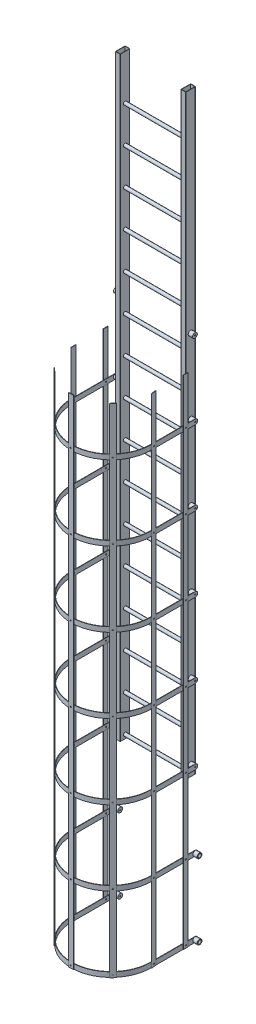
from build123d import *

# Parameters (mm, degrees)
BASE_FLANGE1_DEPTH    = 4900
SKETCH11_R            = 20
SKETCH11_R_2          = 5
BOSS_EXTRUDE2_DEPTH   = 35
BOSS_EXTRUDE2_2_DEPTH = 35
BOSS_EXTRUDE2_3_DEPTH = 35
BOSS_EXTRUDE2_4_DEPTH = 35
BOSS_EXTRUDE2_5_DEPTH = 35
SKETCH8_R             = 13.5
SKETCH8_R_2           = 11
BOSS_EXTRUDE1_DEPTH   = 500
SKETCH13_R            = 5
BASE_FLANGE2_DEPTH    = 3
LPATTERN1_COUNT       = 5
LPATTERN1_PITCH       = 615
BASE_FLANGE4_DEPTH    = 40
LPATTERN2_COUNT       = 7
LPATTERN2_PITCH       = 615
SKETCH62_W            = 40
SKETCH62_H            = 4094.908970127
TAB2_DEPTH            = 3
SKETCH102_R           = 5
CUT_EXTRUDE4_DEPTH    = 6
LPATTERN3_COUNT       = 2
LPATTERN3_PITCH       = 264
LPATTERN12_COUNT      = 2
LPATTERN12_PITCH      = 264
CIRPATTERN1_COUNT     = 5
CIRPATTERN1_ANGLE     = 187
LPATTERN4_COUNT       = 3
LPATTERN4_PITCH       = 615
SKETCH89_R            = 20
SKETCH89_R_2          = 4.25
BOSS_EXTRUDE3_DEPTH   = 35
LPATTERN5_COUNT       = 2
LPATTERN5_PITCH       = 615
SKETCH93_R            = 20
BOSS_EXTRUDE4_DEPTH   = 35
SKETCH94_R            = 4.25
CUT_EXTRUDE1_DEPTH    = 10.78
SKETCH96_R            = 4.25
SKETCH95_R            = 15.025
LPATTERN7_COUNT       = 2
LPATTERN7_PITCH       = 615
LPATTERN8_COUNT       = 2
LPATTERN8_PITCH       = 615


# Sheet-metal steps are written as plain solids
with BuildPart() as part:
    # Sketch1 → Base-Flange1 (new body)
    with BuildSketch(Plane(origin=(0, 0, 0), x_dir=(1, 0, 0), z_dir=(0, 1, 0))):
        with BuildLine():
            Line((-290, 37), (-290, -37))
            ThreePointArc((-290, -37), (-289.121320344, -39.121320344), (-287, -40))
            Line((-287, -40), (-253, -40))
            ThreePointArc((-253, -40), (-250.878679656, -39.121320344), (-250, -37))
            Line((-250, -37), (-250, 37))
            ThreePointArc((-250, 37), (-250.878679656, 39.121320344), (-253, 40))
            Line((-253, 40), (-287, 40))
            ThreePointArc((-287, 40), (-289.121320344, 39.121320344), (-290, 37))
        make_face()
        with BuildLine():
            Line((-287, 37.5), (-253, 37.5))
            ThreePointArc((-253, 37.5), (-252.646446609, 37.353553391), (-252.5, 37))
            Line((-252.5, 37), (-252.5, -37))
            ThreePointArc((-252.5, -37), (-252.646446609, -37.353553391), (-253, -37.5))
            Line((-253, -37.5), (-287, -37.5))
            ThreePointArc((-287, -37.5), (-287.353553391, -37.353553391), (-287.5, -37))
            Line((-287.5, -37), (-287.5, 37))
            ThreePointArc((-287.5, 37), (-287.353553391, 37.353553391), (-287, 37.5))
        make_face(mode=Mode.SUBTRACT)
    extrude(amount=-BASE_FLANGE1_DEPTH)


with BuildPart() as body_2:
    # Sketch11 → Boss-Extrude2 (new body)
    with BuildSketch(Plane.ZY.offset(290)):
        with Locations((0, -4812)):
            Circle(SKETCH11_R)
        with Locations((0, -4812)):
            Circle(SKETCH11_R_2, mode=Mode.SUBTRACT)
    extrude(amount=BOSS_EXTRUDE2_DEPTH)


with BuildPart() as body_3:
    # Sketch11 → Boss-Extrude2 2 (new body)
    with BuildSketch(Plane.ZY.offset(290)):
        with Locations((0, -4197)):
            Circle(SKETCH11_R)
        with Locations((0, -4197)):
            Circle(SKETCH11_R_2, mode=Mode.SUBTRACT)
    extrude(amount=BOSS_EXTRUDE2_2_DEPTH)


with BuildPart() as body_4:
    # Sketch11 → Boss-Extrude2 3 (new body)
    with BuildSketch(Plane.ZY.offset(290)):
        with Locations((0, -3582)):
            Circle(SKETCH11_R)
        with Locations((0, -3582)):
            Circle(SKETCH11_R_2, mode=Mode.SUBTRACT)
    extrude(amount=BOSS_EXTRUDE2_3_DEPTH)


with BuildPart() as body_5:
    # Sketch11 → Boss-Extrude2 4 (new body)
    with BuildSketch(Plane.ZY.offset(290)):
        with Locations((0, -2967)):
            Circle(SKETCH11_R)
        with Locations((0, -2967)):
            Circle(SKETCH11_R_2, mode=Mode.SUBTRACT)
    extrude(amount=BOSS_EXTRUDE2_4_DEPTH)


with BuildPart() as body_6:
    # Sketch11 → Boss-Extrude2 5 (new body)
    with BuildSketch(Plane.ZY.offset(290)):
        with Locations((0, -2352)):
            Circle(SKETCH11_R)
        with Locations((0, -2352)):
            Circle(SKETCH11_R_2, mode=Mode.SUBTRACT)
    extrude(amount=BOSS_EXTRUDE2_5_DEPTH)


with BuildPart() as body_7:
    # Mirror1: mirrored copy
    add(part.part.mirror(Plane(origin=(0, 0, 0), x_dir=(0, 0, 1), z_dir=(1, 0, 0))))


with BuildPart() as body_8:
    # Mirror1 2: mirrored copy
    add(body_2.part.mirror(Plane(origin=(0, 0, 0), x_dir=(0, 0, 1), z_dir=(1, 0, 0))))


with BuildPart() as body_9:
    # Mirror1 3: mirrored copy
    add(body_3.part.mirror(Plane(origin=(0, 0, 0), x_dir=(0, 0, 1), z_dir=(1, 0, 0))))


with BuildPart() as body_10:
    # Mirror1 4: mirrored copy
    add(body_4.part.mirror(Plane(origin=(0, 0, 0), x_dir=(0, 0, 1), z_dir=(1, 0, 0))))


with BuildPart() as body_11:
    # Mirror1 5: mirrored copy
    add(body_5.part.mirror(Plane(origin=(0, 0, 0), x_dir=(0, 0, 1), z_dir=(1, 0, 0))))


with BuildPart() as body_12:
    # Mirror1 6: mirrored copy
    add(body_6.part.mirror(Plane(origin=(0, 0, 0), x_dir=(0, 0, 1), z_dir=(1, 0, 0))))


with BuildPart() as part_1:
    add(part.part)

    add(body_7.part)  # Boss-Extrude1 merges body 7
    # Sketch8 → Boss-Extrude1 (add)
    # profile 1 of 16: a face of its own
    with BuildSketch(Plane(origin=(-250, 0, 0), x_dir=(0, 0, -1), z_dir=(1, 0, 0))):
        with Locations(Location((0, -367, 0), (0, 0, 180))):
            Circle(SKETCH8_R)
        with Locations(Location((0, -367, 0), (0, 0, 180))):
            Circle(SKETCH8_R_2, mode=Mode.SUBTRACT)
    # profile 2 of 16: a face of its own
    with BuildSketch(Plane(origin=(-250, 0, 0), x_dir=(0, 0, -1), z_dir=(1, 0, 0))):
        with Locations(Location((0, -667, 0), (0, 0, 180))):
            Circle(SKETCH8_R)
        with Locations(Location((0, -667, 0), (0, 0, 180))):
            Circle(SKETCH8_R_2, mode=Mode.SUBTRACT)
    # profile 3 of 16: a face of its own
    with BuildSketch(Plane(origin=(-250, 0, 0), x_dir=(0, 0, -1), z_dir=(1, 0, 0))):
        with Locations(Location((0, -967, 0), (0, 0, 180))):
            Circle(SKETCH8_R)
        with Locations(Location((0, -967, 0), (0, 0, 180))):
            Circle(SKETCH8_R_2, mode=Mode.SUBTRACT)
    # profile 4 of 16: a face of its own
    with BuildSketch(Plane(origin=(-250, 0, 0), x_dir=(0, 0, -1), z_dir=(1, 0, 0))):
        with Locations(Location((0, -1267, 0), (0, 0, 180))):
            Circle(SKETCH8_R)
        with Locations(Location((0, -1267, 0), (0, 0, 180))):
            Circle(SKETCH8_R_2, mode=Mode.SUBTRACT)
    # profile 5 of 16: a face of its own
    with BuildSketch(Plane(origin=(-250, 0, 0), x_dir=(0, 0, -1), z_dir=(1, 0, 0))):
        with Locations(Location((0, -1567, 0), (0, 0, 180))):
            Circle(SKETCH8_R)
        with Locations(Location((0, -1567, 0), (0, 0, 180))):
            Circle(SKETCH8_R_2, mode=Mode.SUBTRACT)
    # profile 6 of 16: a face of its own
    with BuildSketch(Plane(origin=(-250, 0, 0), x_dir=(0, 0, -1), z_dir=(1, 0, 0))):
        with Locations(Location((0, -1867, 0), (0, 0, 180))):
            Circle(SKETCH8_R)
        with Locations(Location((0, -1867, 0), (0, 0, 180))):
            Circle(SKETCH8_R_2, mode=Mode.SUBTRACT)
    # profile 7 of 16: a face of its own
    with BuildSketch(Plane(origin=(-250, 0, 0), x_dir=(0, 0, -1), z_dir=(1, 0, 0))):
        with Locations(Location((0, -2167, 0), (0, 0, 180))):
            Circle(SKETCH8_R)
        with Locations(Location((0, -2167, 0), (0, 0, 180))):
            Circle(SKETCH8_R_2, mode=Mode.SUBTRACT)
    # profile 8 of 16: a face of its own
    with BuildSketch(Plane(origin=(-250, 0, 0), x_dir=(0, 0, -1), z_dir=(1, 0, 0))):
        with Locations(Location((0, -2467, 0), (0, 0, 180))):
            Circle(SKETCH8_R)
        with Locations(Location((0, -2467, 0), (0, 0, 180))):
            Circle(SKETCH8_R_2, mode=Mode.SUBTRACT)
    # profile 9 of 16: a face of its own
    with BuildSketch(Plane(origin=(-250, 0, 0), x_dir=(0, 0, -1), z_dir=(1, 0, 0))):
        with Locations(Location((0, -2767, 0), (0, 0, 180))):
            Circle(SKETCH8_R)
        with Locations(Location((0, -2767, 0), (0, 0, 180))):
            Circle(SKETCH8_R_2, mode=Mode.SUBTRACT)
    # profile 10 of 16: a face of its own
    with BuildSketch(Plane(origin=(-250, 0, 0), x_dir=(0, 0, -1), z_dir=(1, 0, 0))):
        with Locations(Location((0, -3067, 0), (0, 0, 180))):
            Circle(SKETCH8_R)
        with Locations(Location((0, -3067, 0), (0, 0, 180))):
            Circle(SKETCH8_R_2, mode=Mode.SUBTRACT)
    # profile 11 of 16: a face of its own
    with BuildSketch(Plane(origin=(-250, 0, 0), x_dir=(0, 0, -1), z_dir=(1, 0, 0))):
        with Locations(Location((0, -3367, 0), (0, 0, 180))):
            Circle(SKETCH8_R)
        with Locations(Location((0, -3367, 0), (0, 0, 180))):
            Circle(SKETCH8_R_2, mode=Mode.SUBTRACT)
    # profile 12 of 16: a face of its own
    with BuildSketch(Plane(origin=(-250, 0, 0), x_dir=(0, 0, -1), z_dir=(1, 0, 0))):
        with Locations(Location((0, -3667, 0), (0, 0, 180))):
            Circle(SKETCH8_R)
        with Locations(Location((0, -3667, 0), (0, 0, 180))):
            Circle(SKETCH8_R_2, mode=Mode.SUBTRACT)
    # profile 13 of 16: a face of its own
    with BuildSketch(Plane(origin=(-250, 0, 0), x_dir=(0, 0, -1), z_dir=(1, 0, 0))):
        with Locations(Location((0, -3967, 0), (0, 0, 180))):
            Circle(SKETCH8_R)
        with Locations(Location((0, -3967, 0), (0, 0, 180))):
            Circle(SKETCH8_R_2, mode=Mode.SUBTRACT)
    # profile 14 of 16: a face of its own
    with BuildSketch(Plane(origin=(-250, 0, 0), x_dir=(0, 0, -1), z_dir=(1, 0, 0))):
        with Locations(Location((0, -4267, 0), (0, 0, 180))):
            Circle(SKETCH8_R)
        with Locations(Location((0, -4267, 0), (0, 0, 180))):
            Circle(SKETCH8_R_2, mode=Mode.SUBTRACT)
    # profile 15 of 16: a face of its own
    with BuildSketch(Plane(origin=(-250, 0, 0), x_dir=(0, 0, -1), z_dir=(1, 0, 0))):
        with Locations(Location((0, -4567, 0), (0, 0, 180))):
            Circle(SKETCH8_R)
        with Locations(Location((0, -4567, 0), (0, 0, 180))):
            Circle(SKETCH8_R_2, mode=Mode.SUBTRACT)
    # profile 16 of 16: a face of its own
    with BuildSketch(Plane(origin=(-250, 0, 0), x_dir=(0, 0, -1), z_dir=(1, 0, 0))):
        with Locations(Location((0, -4867, 0), (0, 0, 180))):
            Circle(SKETCH8_R)
        with Locations(Location((0, -4867, 0), (0, 0, 180))):
            Circle(SKETCH8_R_2, mode=Mode.SUBTRACT)
    extrude(amount=BOSS_EXTRUDE1_DEPTH)


with BuildPart() as body_12_2:
    # Sketch13 → Base-Flange2 (new body)
    with BuildSketch(Plane.ZY.offset(325)):
        with BuildLine():
            Line((0, -4792), (365, -4792))
            Line((365, -4792), (365, -4832))
            Line((365, -4832), (0, -4832))
            ThreePointArc((0, -4832), (-20, -4812), (0, -4792))
        make_face()
        with Locations((0, -4812)):
            Circle(SKETCH13_R, mode=Mode.SUBTRACT)
    extrude(amount=BASE_FLANGE2_DEPTH)


with BuildPart() as lpattern1_1:
    # LPattern1: pattern copy
    add(body_12_2.part.moved(Location(Vector(0, 1, 0) * (1 * LPATTERN1_PITCH))))


with BuildPart() as lpattern1_2:
    # LPattern1: pattern copy
    add(body_12_2.part.moved(Location(Vector(0, 1, 0) * (2 * LPATTERN1_PITCH))))


with BuildPart() as lpattern1_3:
    # LPattern1: pattern copy
    add(body_12_2.part.moved(Location(Vector(0, 1, 0) * (3 * LPATTERN1_PITCH))))


with BuildPart() as lpattern1_4:
    # LPattern1: pattern copy
    add(body_12_2.part.moved(Location(Vector(0, 1, 0) * (4 * LPATTERN1_PITCH))))


with BuildPart() as body_17:
    # Mirror2: mirrored copy
    add(body_12_2.part.mirror(Plane(origin=(0, 0, 0), x_dir=(0, 0, 1), z_dir=(1, 0, 0))))


with BuildPart() as body_18:
    # Mirror2 2: mirrored copy
    add(lpattern1_1.part.mirror(Plane(origin=(0, 0, 0), x_dir=(0, 0, 1), z_dir=(1, 0, 0))))


with BuildPart() as body_19:
    # Mirror2 3: mirrored copy
    add(lpattern1_4.part.mirror(Plane(origin=(0, 0, 0), x_dir=(0, 0, 1), z_dir=(1, 0, 0))))


with BuildPart() as body_20:
    # Mirror2 4: mirrored copy
    add(lpattern1_3.part.mirror(Plane(origin=(0, 0, 0), x_dir=(0, 0, 1), z_dir=(1, 0, 0))))


with BuildPart() as body_21:
    # Mirror2 5: mirrored copy
    add(lpattern1_2.part.mirror(Plane(origin=(0, 0, 0), x_dir=(0, 0, 1), z_dir=(1, 0, 0))))


with BuildPart() as body_22:
    # Sketch50 → Base-Flange4 (new body)
    with BuildSketch(Plane(origin=(0, -2332, 0), x_dir=(1, 0, 0), z_dir=(0, 1, 0))):
        with BuildLine():
            ThreePointArc((325, -365), (0, -690), (-325, -365))
            Line((-325, -365), (-328, -365))
            ThreePointArc((-328, -365), (0, -693), (328, -365))
            Line((328, -365), (325, -365))
        make_face()
    extrude(amount=-BASE_FLANGE4_DEPTH)


with BuildPart() as lpattern2_1:
    # LPattern2: pattern copy
    add(body_22.part.moved(Location(Vector(0, -1, 0) * (1 * LPATTERN2_PITCH))))


with BuildPart() as lpattern2_2:
    # LPattern2: pattern copy
    add(body_22.part.moved(Location(Vector(0, -1, 0) * (2 * LPATTERN2_PITCH))))


with BuildPart() as lpattern2_3:
    # LPattern2: pattern copy
    add(body_22.part.moved(Location(Vector(0, -1, 0) * (3 * LPATTERN2_PITCH))))


with BuildPart() as lpattern2_4:
    # LPattern2: pattern copy
    add(body_22.part.moved(Location(Vector(0, -1, 0) * (4 * LPATTERN2_PITCH))))


with BuildPart() as lpattern2_5:
    # LPattern2: pattern copy
    add(body_22.part.moved(Location(Vector(0, -1, 0) * (5 * LPATTERN2_PITCH))))


with BuildPart() as lpattern2_6:
    # LPattern2: pattern copy
    add(body_22.part.moved(Location(Vector(0, -1, 0) * (6 * LPATTERN2_PITCH))))


with BuildPart() as body_29:
    # Sketch62 → Tab2 (new body)
    with BuildSketch(Plane.ZY.offset(328)):
        with Locations((81, -4014.567407528)):
            Rectangle(SKETCH62_W, SKETCH62_H)
    extrude(amount=TAB2_DEPTH)


with BuildPart() as cut_extrude4_tool:
    # Sketch102 → Cut-Extrude4 (new body)
    with BuildSketch(Plane.ZY.offset(331)):
        with Locations((81, -2967)):
            Circle(SKETCH102_R)
        with Locations((81, -2352)):
            Circle(SKETCH102_R)
        with Locations((81, -3582)):
            Circle(SKETCH102_R)
        with Locations((81, -4197)):
            Circle(SKETCH102_R)
        with Locations((81, -4812)):
            Circle(SKETCH102_R)
        with Locations((81, -5427)):
            Circle(SKETCH102_R)
        with Locations((81, -6042)):
            Circle(SKETCH102_R)
    cut_extrude4 = extrude(amount=-CUT_EXTRUDE4_DEPTH)


with BuildPart() as body_12_2_1:
    add(body_12_2.part)

    # Cut-Extrude4: cut by cut_extrude4_tool
    add(cut_extrude4_tool.part, mode=Mode.SUBTRACT)


with BuildPart() as lpattern1_1_1:
    add(lpattern1_1.part)

    # Cut-Extrude4: cut by cut_extrude4_tool
    add(cut_extrude4_tool.part, mode=Mode.SUBTRACT)


with BuildPart() as lpattern1_2_1:
    add(lpattern1_2.part)

    # Cut-Extrude4: cut by cut_extrude4_tool
    add(cut_extrude4_tool.part, mode=Mode.SUBTRACT)


with BuildPart() as lpattern1_3_1:
    add(lpattern1_3.part)

    # Cut-Extrude4: cut by cut_extrude4_tool
    add(cut_extrude4_tool.part, mode=Mode.SUBTRACT)


with BuildPart() as lpattern1_4_1:
    add(lpattern1_4.part)

    # Cut-Extrude4: cut by cut_extrude4_tool
    add(cut_extrude4_tool.part, mode=Mode.SUBTRACT)


with BuildPart() as body_29_1:
    add(body_29.part)

    # Cut-Extrude4: cut by cut_extrude4_tool
    add(cut_extrude4_tool.part, mode=Mode.SUBTRACT)


with BuildPart() as lpattern3_1:
    # LPattern3: pattern copy
    add(body_29_1.part.moved(Location(Vector(0, 0, 1) * (1 * LPATTERN3_PITCH))))


with BuildPart() as lpattern12_tool:
    # LPattern12: Cut-Extrude4 ×2
    with Locations(*[(0, 0, i * LPATTERN12_PITCH) for i in range(1, LPATTERN12_COUNT)]):
        add(cut_extrude4)


with BuildPart() as body_12_2_2:
    add(body_12_2_1.part)

    # LPattern12: cut by lpattern12_tool
    add(lpattern12_tool.part, mode=Mode.SUBTRACT)


with BuildPart() as lpattern1_1_2:
    add(lpattern1_1_1.part)

    # LPattern12: cut by lpattern12_tool
    add(lpattern12_tool.part, mode=Mode.SUBTRACT)


with BuildPart() as lpattern1_2_2:
    add(lpattern1_2_1.part)

    # LPattern12: cut by lpattern12_tool
    add(lpattern12_tool.part, mode=Mode.SUBTRACT)


with BuildPart() as lpattern1_3_2:
    add(lpattern1_3_1.part)

    # LPattern12: cut by lpattern12_tool
    add(lpattern12_tool.part, mode=Mode.SUBTRACT)


with BuildPart() as lpattern1_4_2:
    add(lpattern1_4_1.part)

    # LPattern12: cut by lpattern12_tool
    add(lpattern12_tool.part, mode=Mode.SUBTRACT)


with BuildPart() as cirpattern1_1:
    # CirPattern1: pattern copy
    add(lpattern3_1.part.rotate(Axis((0, 0, 365), (0, 1, 0)), 1 * CIRPATTERN1_ANGLE / (CIRPATTERN1_COUNT - 1)))


with BuildPart() as cirpattern1_2:
    # CirPattern1: pattern copy
    add(lpattern3_1.part.rotate(Axis((0, 0, 365), (0, 1, 0)), 2 * CIRPATTERN1_ANGLE / (CIRPATTERN1_COUNT - 1)))


with BuildPart() as cirpattern1_3:
    # CirPattern1: pattern copy
    add(lpattern3_1.part.rotate(Axis((0, 0, 365), (0, 1, 0)), 3 * CIRPATTERN1_ANGLE / (CIRPATTERN1_COUNT - 1)))


with BuildPart() as cirpattern1_4:
    # CirPattern1: pattern copy
    add(lpattern3_1.part.rotate(Axis((0, 0, 365), (0, 1, 0)), 4 * CIRPATTERN1_ANGLE / (CIRPATTERN1_COUNT - 1)))


with BuildPart() as body_35:
    # Mirror3: mirrored copy
    add(body_29_1.part.mirror(Plane(origin=(0, 0, 0), x_dir=(0, 0, 1), z_dir=(1, 0, 0))))


with BuildPart() as lpattern4_1:
    # LPattern4: pattern copy
    add(body_17.part.moved(Location(Vector(0, -1, 0) * (1 * LPATTERN4_PITCH))))


with BuildPart() as lpattern4_2:
    # LPattern4: pattern copy
    add(body_17.part.moved(Location(Vector(0, -1, 0) * (2 * LPATTERN4_PITCH))))


with BuildPart() as lpattern4_3:
    # LPattern4: pattern copy
    add(body_12_2_2.part.moved(Location(Vector(0, -1, 0) * (1 * LPATTERN4_PITCH))))


with BuildPart() as lpattern4_4:
    # LPattern4: pattern copy
    add(body_12_2_2.part.moved(Location(Vector(0, -1, 0) * (2 * LPATTERN4_PITCH))))


with BuildPart() as body_40:
    # Sketch89 → Boss-Extrude3 (new body)
    with BuildSketch(Plane(origin=(-325, 0, 0), x_dir=(0, 0, -1), z_dir=(1, 0, 0))):
        with Locations((0, -5427)):
            Circle(SKETCH89_R)
        with Locations((0, -5427)):
            Circle(SKETCH89_R_2, mode=Mode.SUBTRACT)
    extrude(amount=BOSS_EXTRUDE3_DEPTH)


with BuildPart() as lpattern5_1:
    # LPattern5: pattern copy
    add(body_40.part.moved(Location(Vector(0, -1, 0) * (1 * LPATTERN5_PITCH))))


with BuildPart() as body_42:
    # Sketch93 → Boss-Extrude4 (new body)
    with BuildSketch(Plane(origin=(328, 0, 0), x_dir=(0, 0, -1), z_dir=(1, 0, 0))):
        with Locations((0, -5427)):
            Circle(SKETCH93_R)
    extrude(amount=BOSS_EXTRUDE4_DEPTH)

    # Sketch94 → Cut-Extrude1 (cut)
    with BuildSketch(Plane(origin=(363, 0, 0), x_dir=(0, 0, -1), z_dir=(1, 0, 0))):
        with Locations((0, -5427)):
            Circle(SKETCH94_R)
    extrude(amount=-CUT_EXTRUDE1_DEPTH, mode=Mode.SUBTRACT)

    # Sketch96 → Cut-Loft2 section 0
    with BuildSketch(Plane(origin=(352.22, 0, 0), x_dir=(0, 0, -1), z_dir=(1, 0, 0))):
        with Locations((0, -5427)):
            Circle(SKETCH96_R)
    # Sketch95 → Cut-Loft2 section 1
    with BuildSketch(Plane(origin=(363, 0, 0), x_dir=(0, 0, -1), z_dir=(1, 0, 0))):
        with Locations((0, -5427)):
            Circle(SKETCH95_R)
    loft(mode=Mode.SUBTRACT)


with BuildPart() as lpattern7_1:
    # LPattern7: pattern copy
    add(body_42.part.moved(Location(Vector(0, -1, 0) * (1 * LPATTERN7_PITCH))))


with BuildPart() as lpattern8_1:
    # LPattern8: pattern copy
    add(body_6.part.moved(Location(Vector(0, 1, 0) * (1 * LPATTERN8_PITCH))))


with BuildPart() as lpattern8_2:
    # LPattern8: pattern copy
    add(body_12.part.moved(Location(Vector(0, 1, 0) * (1 * LPATTERN8_PITCH))))


solid = Compound([body_2.part, body_3.part, body_4.part, body_5.part, body_6.part, body_8.part, body_9.part, body_10.part, body_11.part, body_12.part, part_1.part, body_17.part, body_18.part, body_19.part, body_20.part, body_21.part, body_22.part, lpattern2_1.part, lpattern2_2.part, lpattern2_3.part, lpattern2_4.part, lpattern2_5.part, lpattern2_6.part, body_29_1.part, lpattern3_1.part, body_12_2_2.part, lpattern1_1_2.part, lpattern1_2_2.part, lpattern1_3_2.part, lpattern1_4_2.part, cirpattern1_1.part, cirpattern1_2.part, cirpattern1_3.part, cirpattern1_4.part, body_35.part, lpattern4_1.part, lpattern4_2.part, lpattern4_3.part, lpattern4_4.part, body_40.part, lpattern5_1.part, body_42.part, lpattern7_1.part, lpattern8_1.part, lpattern8_2.part])
